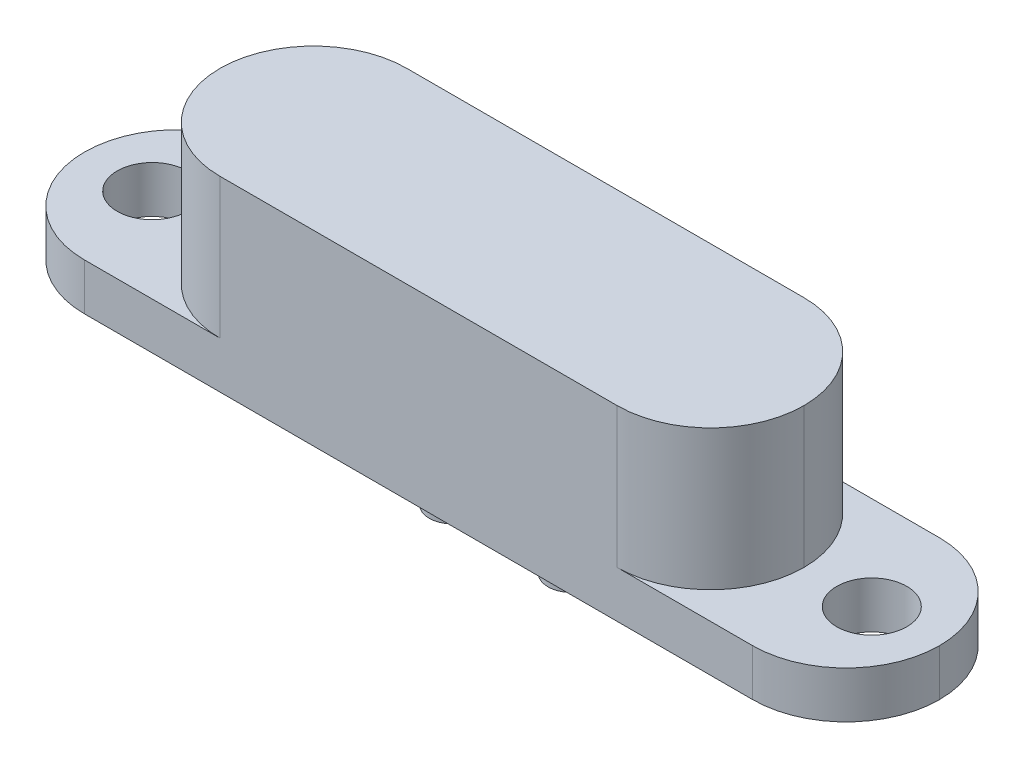
from build123d import *

# Parameters (mm, degrees)
SKETCH_1_W          = 12.5
SKETCH_1_H          = 4
EXTRUDE_1_DEPTH     = 4
FILLET_1_R          = 2
SKETCH_1_3_W        = 18.3
SKETCH_1_3_H        = 4
EXTRUDE_2_DEPTH     = 1
FILLET_2_R          = 2
SKETCH_2_R          = 0.75
CUT_EXTRUDE_1_DEPTH = 10.834759784
EXTRUDE_START       = -4
SKETCH_3_R          = 0.5
EXTRUDE_3_DEPTH     = 5.6


with BuildPart() as part:
    # 草图1 → 凸台-拉伸1 (new body)
    with BuildSketch(Plane(origin=(0, 0, 0), x_dir=(1, 0, 0), z_dir=(0, 1, 0))):
        Rectangle(SKETCH_1_W, SKETCH_1_H)
    extrude(amount=EXTRUDE_1_DEPTH)

    # 圆角1
    fillet_1_edges = [part.edges().sort_by_distance(p)[0] for p in [
        (6.25, 2, -2),
        (6.25, 2, 2),
        (-6.25, 2, 2),
        (-6.25, 2, -2),
    ]]
    fillet(fillet_1_edges, radius=FILLET_1_R - 0.0001)  # a hair under: the kernel refuses the full size

    # 草图1<3> → 凸台-拉伸2 (add)
    with BuildSketch(Plane(origin=(0, 0, 0), x_dir=(1, 0, 0), z_dir=(0, 1, 0))):
        Rectangle(SKETCH_1_3_W, SKETCH_1_3_H)
    extrude(amount=EXTRUDE_2_DEPTH)

    # 圆角2
    fillet_2_edges = [part.edges().sort_by_distance(p)[0] for p in [
        (9.15, 0.5, 2),
        (9.15, 0.5, -2),
        (-9.15, 0.5, 2),
        (-9.15, 0.5, -2),
    ]]
    fillet(fillet_2_edges, radius=FILLET_2_R - 0.0001)  # a hair under: the kernel refuses the full size

    # 草图2 → 切除-拉伸1 (cut, through all)
    with BuildSketch(Plane(origin=(0, 1, 0), x_dir=(1, 0, 0), z_dir=(0, 1, 0))):
        with Locations(Location((-7.7, 0, 0), (0, 0, 270))):
            Circle(SKETCH_2_R)
        with Locations(Location((7.7, 0, 0), (0, 0, 270))):
            Circle(SKETCH_2_R)
    extrude(amount=-CUT_EXTRUDE_1_DEPTH, mode=Mode.SUBTRACT)

    # 草图3 → 凸台-拉伸3 (add)
    with BuildSketch(Plane.XZ.offset(EXTRUDE_START)):
        with Locations(Location((-1.27, 0, 0), (0, 0, 90))):
            Circle(SKETCH_3_R)
        with Locations(Location((1.27, 0, 0), (0, 0, 90))):
            Circle(SKETCH_3_R)
    extrude(amount=EXTRUDE_3_DEPTH)


solid = part.part
